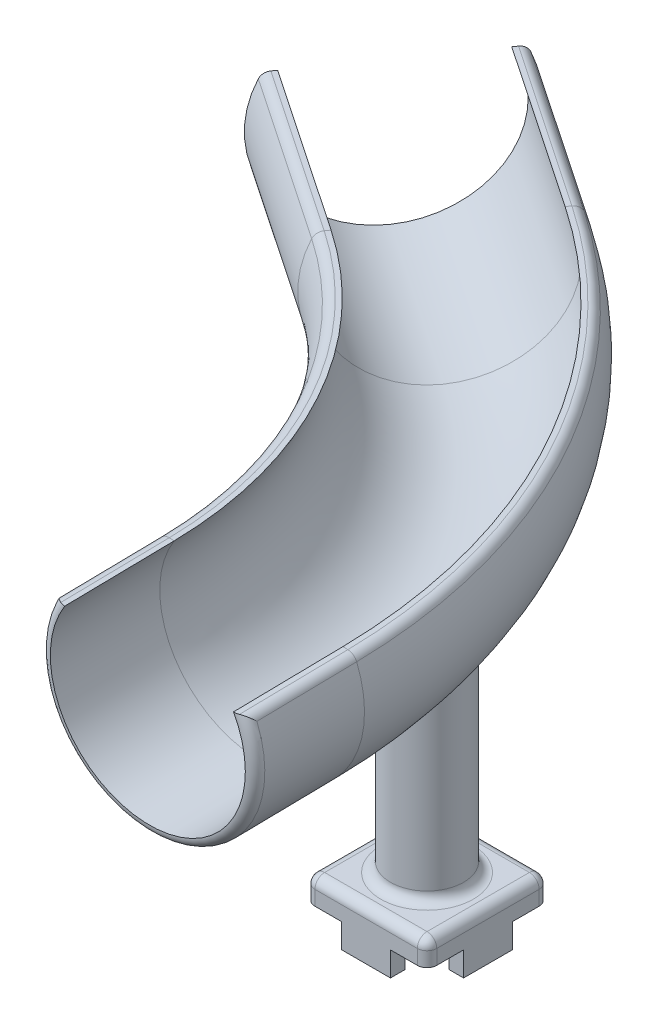
from build123d import *

# Parameters (mm, degrees)
SKETCH8_W                      = 25
SKETCH8_H                      = 25
BOSS_EXTRUDE1_DEPTH            = 5
BOSS_EXTRUDE2_REACH            = 340.536
BOSS_EXTRUDE2_END_MAJOR_RADIUS = 100.405635927
BOSS_EXTRUDE2_END_MINOR_RADIUS = 22
SKETCH9_R                      = 7.5
SKETCH9_R_2                    = 5.5
SKETCH10_W                     = 3
SKETCH10_H                     = 10
SKETCH10_W_2                   = 10
SKETCH10_H_2                   = 3
BOSS_EXTRUDE3_DEPTH            = 5
FILLET1_R                      = 2


with BuildPart() as part:
    # Sweep1: sweep along a path in Sketch5
    with BuildLine(Plane(origin=(0, 0, 0), x_dir=(0.9997397545029943, -0.022809596622636426, -0.00038153401579630816), z_dir=(0.022812787341589733, 0.9995999255318432, 0.016720215621847893))) as sweep1_path:
        Line((194.547507167, -245.220027859), (194.547507167, -222.76492725))
        ThreePointArc((194.547507167, -222.76492725), (182.70523744, -175.56095927), (149.983215305, -139.53703371))
        Line((149.983215305, -139.53703371), (117.214576165, -117.710784863))
    # Sketch7 → Sweep1 (sweep)
    with BuildSketch(Plane(origin=(117.1840716, -4.64227924, 117.649599852), x_dir=(0.5536361283474212, -0.018999100028837552, -0.8325419338307064), z_dir=(0.8320623385601692, -0.028255329561967652, 0.5539620033008825))):
        with BuildLine():
            Line((-17.320508076, 30), (-19.595917942, 30))
            ThreePointArc((-19.595917942, 30), (0, -2), (19.595917942, 30))
            Line((19.595917942, 30), (17.320508076, 30))
            ThreePointArc((17.320508076, 30), (0, 0), (-17.320508076, 30))
        make_face()
    sweep(path=sweep1_path.line)



with BuildPart() as body_2:
    # Sketch8 → Boss-Extrude1 (new body)
    with BuildSketch(Plane(origin=(0, -63.13, 0), x_dir=(1, 0, 0), z_dir=(0, 1, 0))):
        with Locations((182.659431616, -175.469950055)):
            Rectangle(SKETCH8_W, SKETCH8_H)
    extrude(amount=BOSS_EXTRUDE1_DEPTH)


with BuildPart() as part_1:
    add(part.part)

    add(body_2.part)  # Boss-Extrude2 merges body 2
    # Boss-Extrude2: up to this torus (the profile starts outside it)
    boss_extrude2_end = Plane(origin=(94.9790635, 14.105648521, 223.032032588), z_dir=(-0.022812787341589733, -0.9995999255318432, -0.016720215621847893)) * Torus(BOSS_EXTRUDE2_END_MAJOR_RADIUS, BOSS_EXTRUDE2_END_MINOR_RADIUS, mode=Mode.PRIVATE)
    # Sketch9 → Boss-Extrude2 (add, up to the surface)
    with BuildSketch(Plane(origin=(0, -58.13, 0), x_dir=(1, 0, 0), z_dir=(0, 1, 0)), mode=Mode.PRIVATE) as boss_extrude2_sk1:
        with Locations(Location((182.659431616, -175.469950055, 0), (0, 0, 135.488790449))):
            Circle(SKETCH9_R)
        with Locations(Location((182.659431616, -175.469950055, 0), (0, 0, 134.847331682))):
            Circle(SKETCH9_R_2, mode=Mode.SUBTRACT)
    boss_extrude2_tool1 = extrude(boss_extrude2_sk1.sketch, amount=BOSS_EXTRUDE2_REACH, mode=Mode.PRIVATE) - boss_extrude2_end
    add(boss_extrude2_tool1.solids().sort_by_distance((187.856507, -58.13, 180.579101))[0])

    # Sketch10 → Boss-Extrude3 (add)
    with BuildSketch(Plane.XZ.offset(63.13)):
        with Locations((193.659431616, 175.469950055)):
            Rectangle(SKETCH10_W, SKETCH10_H)
        with Locations((182.659431616, 164.469950055)):
            Rectangle(SKETCH10_W_2, SKETCH10_H_2)
        with Locations((171.659431616, 175.469950055)):
            Rectangle(SKETCH10_W, SKETCH10_H)
        with Locations((182.659431616, 186.469950055)):
            Rectangle(SKETCH10_W_2, SKETCH10_H_2)
    extrude(amount=BOSS_EXTRUDE3_DEPTH)

    # Fillet1
    fillet1_edges = [part_1.edges().sort_by_distance(p)[0] for p in [
        (170.159431616, -60.63, 187.969950055),
        (170.159431616, -60.63, 162.969950055),
        (195.159431616, -60.63, 162.969950055),
        (195.159431616, -60.63, 187.969950055),
        (187.938592199, -9.225851682, 180.797281789),
        (188.007781419, -58.13, 180.727816009),
        (182.659431616, -58.13, 187.969950055),
        (170.159431616, -58.13, 175.469950055),
        (182.659431616, -58.13, 162.969950055),
        (195.159431616, -58.13, 175.469950055),
        (123.73657487, 25.156393567, 144.864412221),
        (166.619990229, 23.507355906, 184.94091022),
        (176.211693741, 22.461141905, 234.400915023),
        (215.367137143, 20.772812998, 234.372674502),
        (145.434591152, 24.411783957, 112.235565383),
        (201.136392999, 22.234211756, 166.420730851),
        (194.410707828, -10.536612604, 245.078085501),
    ]]
    fillet(fillet1_edges, radius=FILLET1_R - 0.0001)  # a hair under: the kernel refuses the full size


solid = part_1.part
